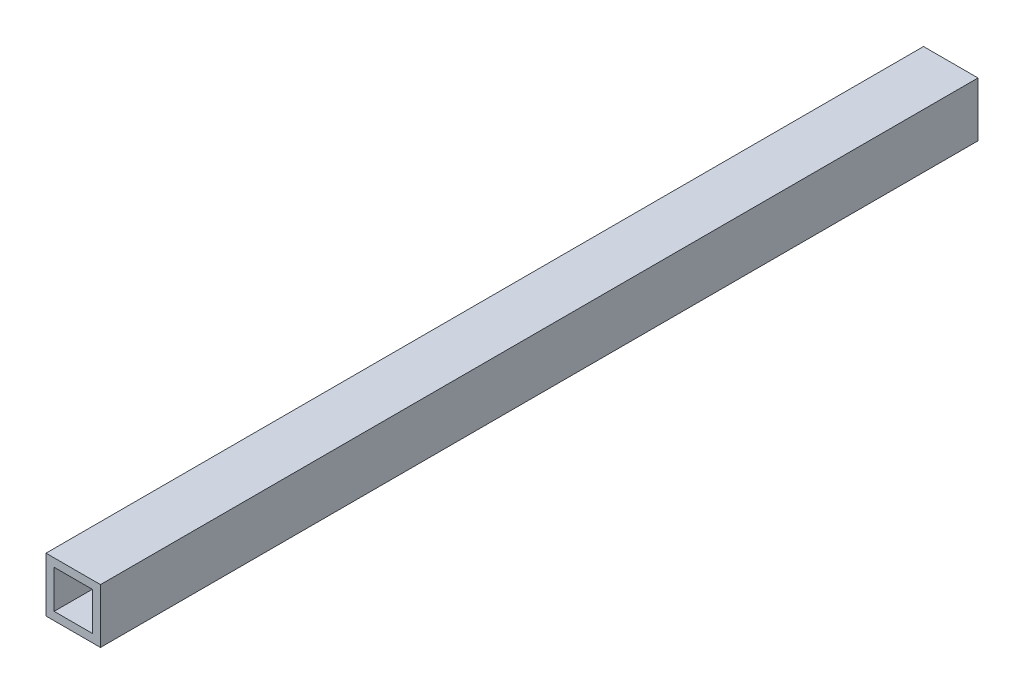
from build123d import *

# Parameters (mm, degrees)
ESQUISSE1_W        = 11.7
ESQUISSE1_H        = 11.7
ESQUISSE1_W_2      = 8.2
ESQUISSE1_H_2      = 8.2
BOSS_EXTRU_1_DEPTH = 188.5


with BuildPart() as part:
    # Esquisse1 → Boss.-Extru.1 (new body)
    with BuildSketch(Plane.XY):
        with Locations((5.85, 5.85)):
            Rectangle(ESQUISSE1_W, ESQUISSE1_H)
        with Locations((5.85, 5.85)):
            Rectangle(ESQUISSE1_W_2, ESQUISSE1_H_2, mode=Mode.SUBTRACT)
    extrude(amount=BOSS_EXTRU_1_DEPTH)


solid = part.part
